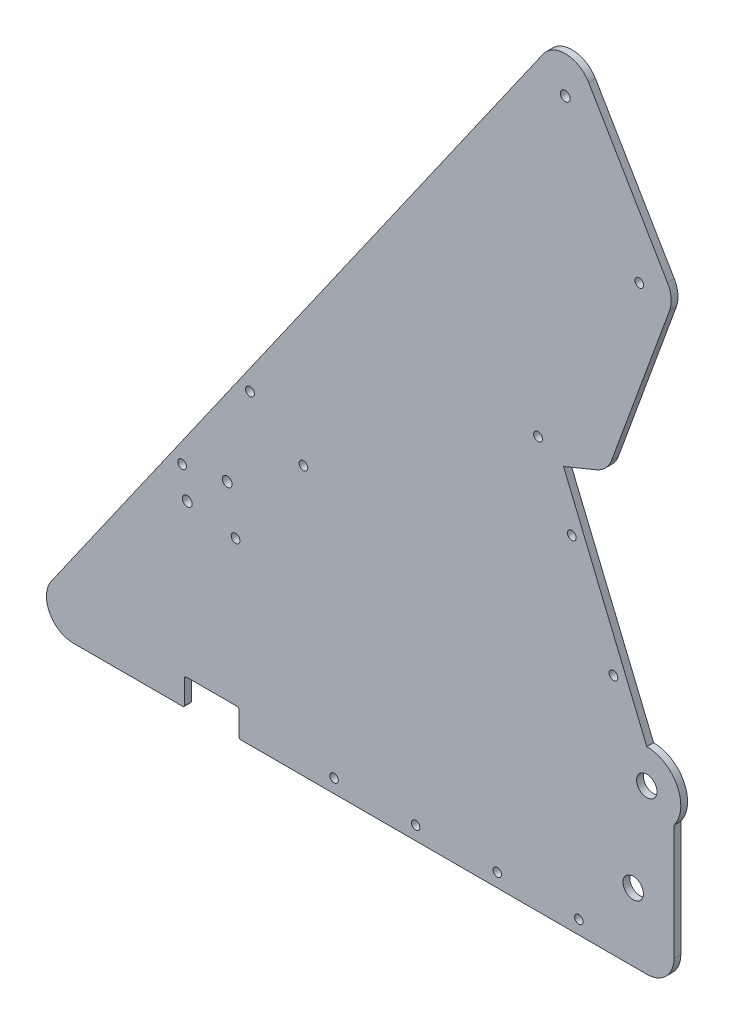
from build123d import *

# Parameters (mm, degrees)
BOSS_EXTRUDE1_DEPTH = 3.175
SKETCH2_R           = 2.286
SKETCH2_R_2         = 2.032
SKETCH2_R_3         = 4.7625
SKETCH2_R_4         = 1.96820932
CUT_EXTRUDE1_DEPTH  = 477.903574071
FILLET1_R           = 12.7
FILLET2_R           = 0.79375


with BuildPart() as part:
    # Sketch1 → Boss-Extrude1 (new body)
    with BuildSketch(Plane.XY):
        with BuildLine():
            Line((0, 0), (76.2, 0))
            Line((76.2, 0), (76.2, 12.7))
            Line((76.2, 12.7), (101.6, 12.7))
            Line((101.6, 12.7), (101.6, 0))
            Line((101.6, 0), (304.8, 0))
            Line((304.8, 0), (304.8, 66.675))
            ThreePointArc((304.8, 66.675), (306.299031657, 83.299515829), (292.1, 92.075))
            Line((292.1, 92.075), (253.219363272, 185.941160503))
            Line((253.219363272, 185.941160503), (273.752585882, 194.446299787))
            Line((273.752585882, 194.446299787), (304.8, 279.4))
            Line((304.8, 279.4), (254.954725958, 364.113083686))
            Line((254.954725958, 364.113083686), (0, 0))
        make_face()
    extrude(amount=BOSS_EXTRUDE1_DEPTH)

    # Sketch2 → Cut-Extrude1 (cut, through all)
    with BuildSketch(Plane.XY.offset(3.175)):
        with Locations((77.458296873, 84.051783119)):
            Circle(SKETCH2_R)
        with Locations((254, 336.179464547)):
            Circle(SKETCH2_R)
        with Locations((96.115774714, 101.28716883)):
            Circle(SKETCH2_R)
        with Locations((257.072887422, 160.044580582)):
            Circle(SKETCH2_R_2)
        with Locations((292.1, 76.2)):
            Circle(SKETCH2_R_3)
        with Locations((184.15, 6.35)):
            Circle(SKETCH2_R_4)
        with Locations((222.25, 6.35)):
            Circle(SKETCH2_R_4)
        with Locations((260.35, 6.35)):
            Circle(SKETCH2_R_4)
        with Locations((276.513205786, 113.11150033)):
            Circle(SKETCH2_R_2)
        with Locations((288.600184498, 277.926110751)):
            Circle(SKETCH2_R_2)
        with Locations((285.75, 31.75)):
            Circle(SKETCH2_R_3)
        with Locations((106.759933414, 143.058732026)):
            Circle(SKETCH2_R_2)
        with Locations((241.3, 192.0875)):
            Circle(SKETCH2_R_2)
        with Locations((75.072703188, 97.804677339)):
            Circle(SKETCH2_R_2)
        with Locations((100.040457498, 80.322067559)):
            Circle(SKETCH2_R_2)
        with Locations((131.727687724, 125.576122246)):
            Circle(SKETCH2_R_2)
        with Locations((146.05, 6.35)):
            Circle(SKETCH2_R_4)
    extrude(amount=-CUT_EXTRUDE1_DEPTH, mode=Mode.SUBTRACT)

    # Fillet1
    fillet1_edges = [part.edges().sort_by_distance(p)[0] for p in [
        (0, 0, 1.5875),
        (304.8, 0, 1.5875),
        (254.954725958, 364.113083686, 1.5875),
        (273.752585882, 194.446299787, 1.5875),
        (304.8, 279.4, 1.5875),
    ]]
    fillet(fillet1_edges, radius=FILLET1_R)

    # Fillet2
    fillet2_edges = [part.edges().sort_by_distance(p)[0] for p in [
        (101.6, 0, 1.5875),
        (101.6, 12.7, 1.5875),
        (76.2, 0, 1.5875),
        (76.2, 12.7, 1.5875),
    ]]
    fillet(fillet2_edges, radius=FILLET2_R)


solid = part.part
